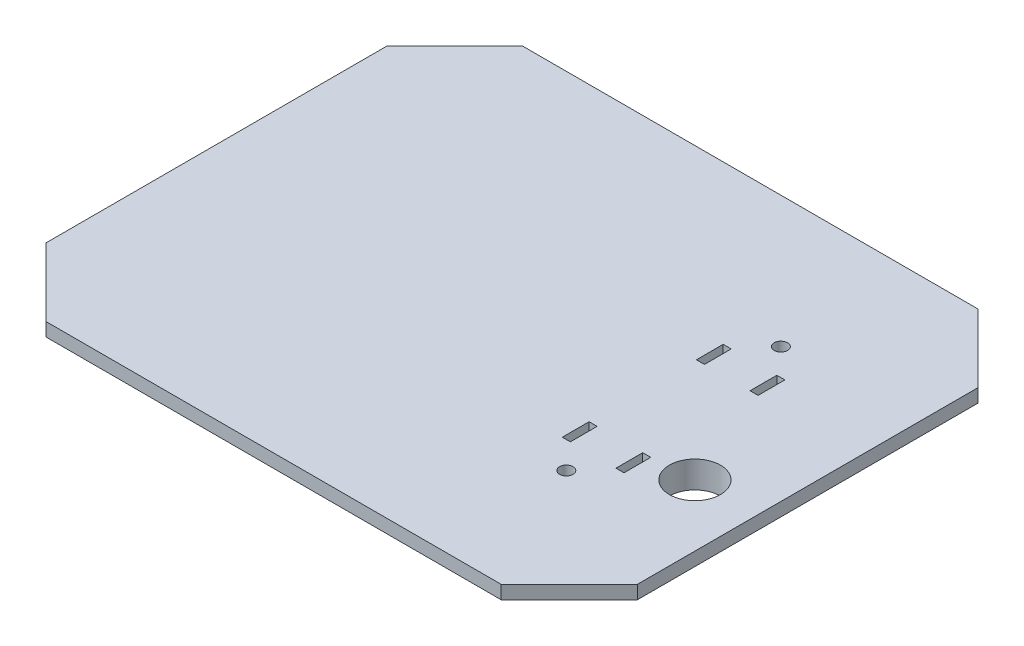
from build123d import *

# Parameters (mm, degrees)
SKETCH2_W               = 190.5
SKETCH2_H               = 177.8
BOSS_EXTRUDE1_DEPTH     = 5.08
CHAMFER1_SIZE           = 25.4
BOSS_EXTRUDE3_DEPTH     = 68.42
SKETCH5_R               = 9
SKETCH5_R_2             = 1.5
CUT_EXTRUDE1_DEPTH      = 231.530019737
SKETCH10_W              = 177.8
SKETCH10_H              = 73.5
BOSS_EXTRUDE6_DEPTH     = 30
CHAMFER3_SIZE           = 25.4
CUT_EXTRUDE2_DEPTH      = 68.42
BOSS_EXTRUDE7_START     = 38.1
BOSS_EXTRUDE7_DEPTH     = 10
SKETCH13_W              = 15.24
SKETCH13_H              = 10
BOSS_EXTRUDE8_DEPTH     = 7
SKETCH14_R              = 2.5
CUT_EXTRUDE3_DEPTH      = 10
MIRROR4_COPY_1_SKETCH_W = 15.24
MIRROR4_COPY_1_SKETCH_H = 10
MIRROR4_COPY_1_DEPTH    = 7
MIRROR4_COPY_2_SKETCH_R = 2.5
MIRROR4_COPY_2_DEPTH    = 10
BOSS_EXTRUDE9_START     = 5
BOSS_EXTRUDE9_DEPTH     = 5
BOSS_EXTRUDE10_START    = 10
BOSS_EXTRUDE10_DEPTH    = 5
SKETCH16_R              = 2.5
CUT_EXTRUDE4_DEPTH      = 163.946494286
SKETCH17_W              = 3
SKETCH17_H              = 10
CUT_EXTRUDE5_DEPTH      = 163.946494286
BOSS_EXTRUDE11_START    = 10
SKETCH18_W              = 3
SKETCH18_H              = 10
BOSS_EXTRUDE11_DEPTH    = 10
BOSS_EXTRUDE11_2_DEPTH  = 10
BOSS_EXTRUDE11_3_DEPTH  = 10
BOSS_EXTRUDE11_4_DEPTH  = 10
SKETCH19_W              = 23
SKETCH19_H              = 60
BOSS_EXTRUDE12_DEPTH    = 20
CHAMFER5_SIZE           = 5.724341006
CHAMFER5_SIZE_2         = 0.3
BOSS_EXTRUDE13_START    = -20
SKETCH20_R              = 2.5
BOSS_EXTRUDE13_DEPTH    = 4
SKETCH21_R              = 9.525
CUT_EXTRUDE6_DEPTH      = 10


with BuildPart() as part:
    # Sketch2 → Boss-Extrude1 (new body)
    with BuildSketch(Plane(origin=(0, 0, 0), x_dir=(1, 0, 0), z_dir=(0, 1, 0))):
        with Locations((-31.75, -12.7)):
            Rectangle(SKETCH2_W, SKETCH2_H)
    extrude(amount=BOSS_EXTRUDE1_DEPTH)

    # Chamfer1
    chamfer1_edges = [part.edges().sort_by_distance(p)[0] for p in [
        (-127, 2.54, -76.2),
        (-127, 2.54, 101.6),
    ]]
    chamfer(chamfer1_edges, length=CHAMFER1_SIZE)

    # Sketch4 → Boss-Extrude3 (add)
    with BuildSketch(Plane(origin=(0, 5.08, 0), x_dir=(1, 0, 0), z_dir=(0, 1, 0))):
        Polygon((57.15, 69.85), (-98.969743879, 69.85), (-120.65, 48.169743879), (-120.65, -73.569743879), (-98.969743879, -95.25), (57.15, -95.25), (63.5, -95.25), (63.5, -101.6), (-101.6, -101.6), (-127, -76.2), (-127, 50.8), (-101.6, 76.2), (63.5, 76.2), (63.5, 69.85), align=None)
    extrude(amount=BOSS_EXTRUDE3_DEPTH)

    # Sketch5 → Cut-Extrude1 (cut, through all)
    with BuildSketch(Plane.XY.offset(101.6)):
        with Locations((-50.8, 31.75)):
            Circle(SKETCH5_R)
        with Locations((-50.8, 47.25)):
            Circle(SKETCH5_R_2)
        with Locations((-37.376606241, 39.5)):
            Circle(SKETCH5_R_2)
        with Locations((-37.376606241, 24)):
            Circle(SKETCH5_R_2)
        with Locations((-50.8, 16.25)):
            Circle(SKETCH5_R_2)
        with Locations((-64.223393759, 24)):
            Circle(SKETCH5_R_2)
        with Locations((-64.223393759, 39.5)):
            Circle(SKETCH5_R_2)
    extrude(amount=-CUT_EXTRUDE1_DEPTH, mode=Mode.SUBTRACT)

    # Sketch10 → Boss-Extrude6 (add)
    with BuildSketch(Plane(origin=(63.5, 0, 0), x_dir=(0, 0, -1), z_dir=(1, 0, 0))):
        with Locations((-12.7, 36.75)):
            Rectangle(SKETCH10_W, SKETCH10_H)
    extrude(amount=BOSS_EXTRUDE6_DEPTH)

    # Chamfer3
    chamfer3_edges = [part.edges().sort_by_distance(p)[0] for p in [
        (93.5, 36.75, 101.6),
        (93.5, 36.75, -76.2),
    ]]
    chamfer(chamfer3_edges, length=CHAMFER3_SIZE)

    # Sketch11 → Cut-Extrude2 (cut)
    with BuildSketch(Plane(origin=(0, 73.5, 0), x_dir=(1, 0, 0), z_dir=(0, 1, 0))):
        Polygon((85.757180746, -72.992819254), (85.757180746, 47.592819254), (63.5, 69.85), (63.5, -95.25), align=None)
    extrude(amount=-CUT_EXTRUDE2_DEPTH, mode=Mode.SUBTRACT)

    # Sketch12 → Boss-Extrude7 (add)
    with BuildSketch(Plane(origin=(0, 0, 95.25), x_dir=(-1, 0, 0), z_dir=(0, 0, -1)).offset(BOSS_EXTRUDE7_START)):
        with BuildLine():
            Line((25.8, 5.08), (75.8, 5.08))
            Line((75.8, 5.08), (75.8, 31.75))
            Line((75.8, 31.75), (69.8, 31.75))
            ThreePointArc((69.8, 31.75), (50.8, 12.75), (31.8, 31.75))
            Line((31.8, 31.75), (25.8, 31.75))
            Line((25.8, 31.75), (25.8, 5.08))
        make_face()
    boss_extrude7 = extrude(amount=BOSS_EXTRUDE7_DEPTH)

    # Sketch13 → Boss-Extrude8 (add)
    with BuildSketch(Plane(origin=(0, 31.75, 0), x_dir=(1, 0, 0), z_dir=(0, 1, 0))):
        with Locations((-24.18, -52.15)):
            Rectangle(SKETCH13_W, SKETCH13_H)
    boss_extrude8 = extrude(amount=-BOSS_EXTRUDE8_DEPTH)

    # Sketch14 → Cut-Extrude3 (cut)
    with BuildSketch(Plane(origin=(0, 31.75, 0), x_dir=(1, 0, 0), z_dir=(0, 1, 0))):
        with Locations(Location((-20.37, -52.15, 0), (0, 0, 270))):
            Circle(SKETCH14_R)
    cut_extrude3 = extrude(amount=-CUT_EXTRUDE3_DEPTH, mode=Mode.SUBTRACT)

    # Mirror2: Boss-Extrude8 across plane
    add(boss_extrude8.mirror(Plane.ZY.offset(50.8)))

    # Mirror3: Cut-Extrude3 across plane
    add(cut_extrude3.mirror(Plane.ZY.offset(50.8)), mode=Mode.SUBTRACT)

    # Mirror4: Boss-Extrude7, Boss-Extrude8, Cut-Extrude3 across plane
    add(boss_extrude7.mirror(Plane.XY.offset(12.7)))
    add(boss_extrude8.mirror(Plane.XY.offset(12.7)))
    add(cut_extrude3.mirror(Plane.XY.offset(12.7)), mode=Mode.SUBTRACT)

    # Mirror4 copy 1 sketch → Mirror4 copy 1 (add)
    with BuildSketch(Plane(origin=(-101.6, 31.75, 25.4), x_dir=(-1, 0, 0), z_dir=(0, 1, 0))):
        with Locations((-24.18, -52.15)):
            Rectangle(MIRROR4_COPY_1_SKETCH_W, MIRROR4_COPY_1_SKETCH_H)
    extrude(amount=-MIRROR4_COPY_1_DEPTH)

    # Mirror4 copy 2 sketch → Mirror4 copy 2 (cut)
    with BuildSketch(Plane(origin=(-101.6, 31.75, 25.4), x_dir=(-1, 0, 0), z_dir=(0, 1, 0))):
        with Locations(Location((-20.37, -52.15, 0), (0, 0, 270))):
            Circle(MIRROR4_COPY_2_SKETCH_R)
    extrude(amount=-MIRROR4_COPY_2_DEPTH, mode=Mode.SUBTRACT)


with BuildPart() as body_2:
    # Sketch15 → Boss-Extrude9 (new body)
    with BuildSketch(Plane(origin=(0, 73.5, 0), x_dir=(1, 0, 0), z_dir=(0, 1, 0)).offset(BOSS_EXTRUDE9_START)):
        Polygon((85.757180746, 47.592819254), (63.5, 69.85), (-98.969743879, 69.85), (-120.65, 48.169743879), (-120.65, -73.569743879), (-98.969743879, -95.25), (63.5, -95.25), (85.757180746, -72.992819254), align=None)
    extrude(amount=BOSS_EXTRUDE9_DEPTH)

    # Sketch15<3> → Boss-Extrude10 (add)
    with BuildSketch(Plane(origin=(0, 73.5, 0), x_dir=(1, 0, 0), z_dir=(0, 1, 0)).offset(BOSS_EXTRUDE10_START)):
        Polygon((68.1, -101.6), (93.5, -76.2), (93.5, 50.8), (68.1, 76.2), (-101.6, 76.2), (-127, 50.8), (-127, -76.2), (-101.6, -101.6), align=None)
    extrude(amount=BOSS_EXTRUDE10_DEPTH)

    # Sketch16 → Cut-Extrude4 (cut, through all)
    with BuildSketch(Plane(origin=(0, 88.5, 0), x_dir=(1, 0, 0), z_dir=(0, 1, 0))):
        with Locations(Location((43.5, 27.3, 0), (0, 0, 270))):
            Circle(SKETCH16_R)
        with Locations(Location((43.5, -52.7, 0), (0, 0, 270))):
            Circle(SKETCH16_R)
    extrude(amount=-CUT_EXTRUDE4_DEPTH, mode=Mode.SUBTRACT)

    # Sketch17 → Cut-Extrude5 (cut, through all)
    with BuildSketch(Plane(origin=(0, 88.5, 0), x_dir=(1, 0, 0), z_dir=(0, 1, 0))):
        with Locations((33.5, 12.3)):
            Rectangle(SKETCH17_W, SKETCH17_H)
        with Locations((53.5, 12.3)):
            Rectangle(SKETCH17_W, SKETCH17_H)
        with Locations((33.5, -37.7)):
            Rectangle(SKETCH17_W, SKETCH17_H)
        with Locations((53.5, -37.7)):
            Rectangle(SKETCH17_W, SKETCH17_H)
    extrude(amount=-CUT_EXTRUDE5_DEPTH, mode=Mode.SUBTRACT)

    # Chamfer5
    # the kernel refuses this chamfer: 5.724341006, 0.3 mm, written as the material it takes off along each edge
    with BuildSketch(Plane(origin=(52.976460511, 78.5, 105.773539489), x_dir=(0.0014234225126538123, 0.999997973866298, 0.0014234225126538165), z_dir=(0.7071067811865485, 0, -0.7071067811865466))) as chamfer5_piece_1_section:
        Polygon((CHAMFER5_SIZE * 0.999997973922, -CHAMFER5_SIZE * 0.00201302342249), (-CHAMFER5_SIZE_2 * 0.00201302342238, -CHAMFER5_SIZE_2 * 0.999997973866), (0, 0), align=None)
    chamfer5_piece_1 = extrude(amount=61.24147141, mode=Mode.PRIVATE)
    chamfer5_piece_1 = split(chamfer5_piece_1, bisect_by=Plane(origin=(74.599777389, 83.5, 84.092596643), z_dir=(0, -1, 0)), keep=Keep.TOP, mode=Mode.PRIVATE)
    add(chamfer5_piece_1, mode=Mode.SUBTRACT)
    with BuildSketch(Plane(origin=(-113.852276148, 78.5, 95.25), x_dir=(0, 0.999997973866298, 0.002013023422382438), z_dir=(1, 0, 0))) as chamfer5_piece_2_section:
        Polygon((CHAMFER5_SIZE * 0.999997973922, -CHAMFER5_SIZE * 0.00201302342249), (-CHAMFER5_SIZE_2 * 0.00201302342238, -CHAMFER5_SIZE_2 * 0.999997973866), (0, 0), align=None)
    chamfer5_piece_2 = extrude(amount=192.234808418, mode=Mode.PRIVATE)
    chamfer5_piece_2 = split(chamfer5_piece_2, bisect_by=Plane(origin=(-17.734871939, 83.5, 95.209252287), z_dir=(0, -1, 0)), keep=Keep.TOP, mode=Mode.PRIVATE)
    add(chamfer5_piece_2, mode=Mode.SUBTRACT)
    with BuildSketch(Plane(origin=(-131.173539489, 78.5, 63.04620439), x_dir=(-0.0014234225126544158, 0.999997973866298, 0.0014234225126544065), z_dir=(0.7071067811865452, 0, 0.7071067811865498))) as chamfer5_piece_3_section:
        Polygon((CHAMFER5_SIZE * 0.999997973922, -CHAMFER5_SIZE * 0.00201302342249), (-CHAMFER5_SIZE_2 * 0.00201302342238, -CHAMFER5_SIZE_2 * 0.999997973866), (0, 0), align=None)
    chamfer5_piece_3 = extrude(amount=60.425576781, mode=Mode.PRIVATE)
    chamfer5_piece_3 = split(chamfer5_piece_3, bisect_by=Plane(origin=(-109.781058955, 83.5, 84.381058955), z_dir=(0, -1, 0)), keep=Keep.TOP, mode=Mode.PRIVATE)
    add(chamfer5_piece_3, mode=Mode.SUBTRACT)
    with BuildSketch(Plane(origin=(-120.65, 78.5, -63.052276148), x_dir=(-0.002013023422382438, 0.999997973866298, 0), z_dir=(0, 0, 1))) as chamfer5_piece_4_section:
        Polygon((CHAMFER5_SIZE * 0.999997973922, -CHAMFER5_SIZE * 0.00201302342249), (-CHAMFER5_SIZE_2 * 0.00201302342238, -CHAMFER5_SIZE_2 * 0.999997973866), (0, 0), align=None)
    chamfer5_piece_4 = extrude(amount=151.504552297, mode=Mode.PRIVATE)
    chamfer5_piece_4 = split(chamfer5_piece_4, bisect_by=Plane(origin=(-120.609252287, 83.5, 12.7), z_dir=(0, -1, 0)), keep=Keep.TOP, mode=Mode.PRIVATE)
    add(chamfer5_piece_4, mode=Mode.SUBTRACT)
    with BuildSketch(Plane(origin=(-88.44620439, 78.5, -80.373539489), x_dir=(-0.001423422512653215, 0.999997973866298, -0.0014234225126532204), z_dir=(-0.7071067811865488, 0, 0.7071067811865462))) as chamfer5_piece_5_section:
        Polygon((CHAMFER5_SIZE * 0.999997973922, -CHAMFER5_SIZE * 0.0020130234225), (-CHAMFER5_SIZE_2 * 0.00201302342238, -CHAMFER5_SIZE_2 * 0.999997973866), (0, 0), align=None)
    chamfer5_piece_5 = extrude(amount=60.425576781, mode=Mode.PRIVATE)
    chamfer5_piece_5 = split(chamfer5_piece_5, bisect_by=Plane(origin=(-109.781058955, 83.5, -58.981058955), z_dir=(0, -1, 0)), keep=Keep.TOP, mode=Mode.PRIVATE)
    add(chamfer5_piece_5, mode=Mode.SUBTRACT)
    with BuildSketch(Plane(origin=(78.382532269, 78.5, -69.85), x_dir=(0, 0.999997973866298, -0.002013023422382438), z_dir=(-1, 0, 0))) as chamfer5_piece_6_section:
        Polygon((CHAMFER5_SIZE * 0.999997973922, -CHAMFER5_SIZE * 0.00201302342249), (-CHAMFER5_SIZE_2 * 0.00201302342238, -CHAMFER5_SIZE_2 * 0.999997973866), (0, 0), align=None)
    chamfer5_piece_6 = extrude(amount=192.234808418, mode=Mode.PRIVATE)
    chamfer5_piece_6 = split(chamfer5_piece_6, bisect_by=Plane(origin=(-17.734871939, 83.5, -69.809252287), z_dir=(0, -1, 0)), keep=Keep.TOP, mode=Mode.PRIVATE)
    add(chamfer5_piece_6, mode=Mode.SUBTRACT)
    with BuildSketch(Plane(origin=(96.280720235, 78.5, -37.069279765), x_dir=(0.0014234225126538128, 0.999997973866298, -0.0014234225126538162), z_dir=(-0.7071067811865483, 0, -0.7071067811865467))) as chamfer5_piece_7_section:
        Polygon((CHAMFER5_SIZE * 0.999997973922, -CHAMFER5_SIZE * 0.00201302342249), (-CHAMFER5_SIZE_2 * 0.00201302342238, -CHAMFER5_SIZE_2 * 0.999997973866), (0, 0), align=None)
    chamfer5_piece_7 = extrude(amount=61.24147141, mode=Mode.PRIVATE)
    chamfer5_piece_7 = split(chamfer5_piece_7, bisect_by=Plane(origin=(74.599777389, 83.5, -58.692596643), z_dir=(0, -1, 0)), keep=Keep.TOP, mode=Mode.PRIVATE)
    add(chamfer5_piece_7, mode=Mode.SUBTRACT)
    with BuildSketch(Plane(origin=(85.757180746, 78.5, 87.875351523), x_dir=(0.002013023422382438, 0.999997973866298, 0), z_dir=(0, 0, -1))) as chamfer5_piece_8_section:
        Polygon((CHAMFER5_SIZE * 0.999997973922, -CHAMFER5_SIZE * 0.00201302342249), (-CHAMFER5_SIZE_2 * 0.00201302342238, -CHAMFER5_SIZE_2 * 0.999997973866), (0, 0), align=None)
    chamfer5_piece_8 = extrude(amount=150.350703047, mode=Mode.PRIVATE)
    chamfer5_piece_8 = split(chamfer5_piece_8, bisect_by=Plane(origin=(85.716433033, 83.5, 12.7), z_dir=(0, -1, 0)), keep=Keep.TOP, mode=Mode.PRIVATE)
    add(chamfer5_piece_8, mode=Mode.SUBTRACT)

    # Sketch21 → Cut-Extrude6 (cut)
    with BuildSketch(Plane(origin=(0, 88.5, 0), x_dir=(1, 0, 0), z_dir=(0, 1, 0))):
        with Locations(Location((70.5, -31.75, 0), (0, 0, 270))):
            Circle(SKETCH21_R)
    extrude(amount=-CUT_EXTRUDE6_DEPTH, mode=Mode.SUBTRACT)


with BuildPart() as body_2_2:
    # Sketch18 → Boss-Extrude11 (new body)
    with BuildSketch(Plane(origin=(0, 88.5, 0), x_dir=(1, 0, 0), z_dir=(0, 1, 0)).offset(BOSS_EXTRUDE11_START)):
        with Locations((53.5, -37.7)):
            Rectangle(SKETCH18_W, SKETCH18_H)
    extrude(amount=BOSS_EXTRUDE11_DEPTH)



with BuildPart() as body_3:
    # Sketch18 → Boss-Extrude11 2 (new body)
    with BuildSketch(Plane(origin=(0, 88.5, 0), x_dir=(1, 0, 0), z_dir=(0, 1, 0)).offset(BOSS_EXTRUDE11_START)):
        with Locations((33.5, -37.7)):
            Rectangle(SKETCH18_W, SKETCH18_H)
    extrude(amount=BOSS_EXTRUDE11_2_DEPTH)


with BuildPart() as body_4:
    # Sketch18 → Boss-Extrude11 3 (new body)
    with BuildSketch(Plane(origin=(0, 88.5, 0), x_dir=(1, 0, 0), z_dir=(0, 1, 0)).offset(BOSS_EXTRUDE11_START)):
        with Locations((33.5, 12.3)):
            Rectangle(SKETCH18_W, SKETCH18_H)
    extrude(amount=BOSS_EXTRUDE11_3_DEPTH)


with BuildPart() as body_5:
    # Sketch18 → Boss-Extrude11 4 (new body)
    with BuildSketch(Plane(origin=(0, 88.5, 0), x_dir=(1, 0, 0), z_dir=(0, 1, 0)).offset(BOSS_EXTRUDE11_START)):
        with Locations((53.5, 12.3)):
            Rectangle(SKETCH18_W, SKETCH18_H)
    extrude(amount=BOSS_EXTRUDE11_4_DEPTH)


with BuildPart() as body_2_2_1:
    add(body_2_2.part)

    add(body_3.part)  # Boss-Extrude12 merges body 3

    add(body_4.part)  # Boss-Extrude12 merges body 4

    add(body_5.part)  # Boss-Extrude12 merges body 5
    # Sketch19 → Boss-Extrude12 (add)
    with BuildSketch(Plane(origin=(0, 108.5, 0), x_dir=(1, 0, 0), z_dir=(0, 1, 0))):
        with Locations((43.5, -12.7)):
            Rectangle(SKETCH19_W, SKETCH19_H)
    extrude(amount=BOSS_EXTRUDE12_DEPTH)

    # Sketch20 → Boss-Extrude13 (add)
    # profile 1 of 2: a face of its own
    with BuildSketch(Plane(origin=(0, 128.5, 0), x_dir=(1, 0, 0), z_dir=(0, 1, 0)).offset(BOSS_EXTRUDE13_START)):
        with BuildLine():
            Line((32, 17.3), (39.162824532, 29.787751788))
            ThreePointArc((39.162824532, 29.787751788), (43.5, 32.3), (47.837175468, 29.787751788))
            Line((47.837175468, 29.787751788), (55, 17.3))
            Line((55, 17.3), (32, 17.3))
        make_face()
        with Locations(Location((43.5, 27.3, 0), (0, 0, 270))):
            Circle(SKETCH20_R, mode=Mode.SUBTRACT)
    # profile 2 of 2: a face of its own
    with BuildSketch(Plane(origin=(0, 128.5, 0), x_dir=(1, 0, 0), z_dir=(0, 1, 0)).offset(BOSS_EXTRUDE13_START)):
        with BuildLine():
            Line((55, -42.7), (47.837175468, -55.187751788))
            ThreePointArc((47.837175468, -55.187751788), (43.5, -57.7), (39.162824532, -55.187751788))
            Line((39.162824532, -55.187751788), (32, -42.7))
            Line((32, -42.7), (55, -42.7))
        make_face()
        with Locations(Location((43.5, -52.7, 0), (0, 0, 270))):
            Circle(SKETCH20_R, mode=Mode.SUBTRACT)
    extrude(amount=BOSS_EXTRUDE13_DEPTH)


solid = body_2.part
